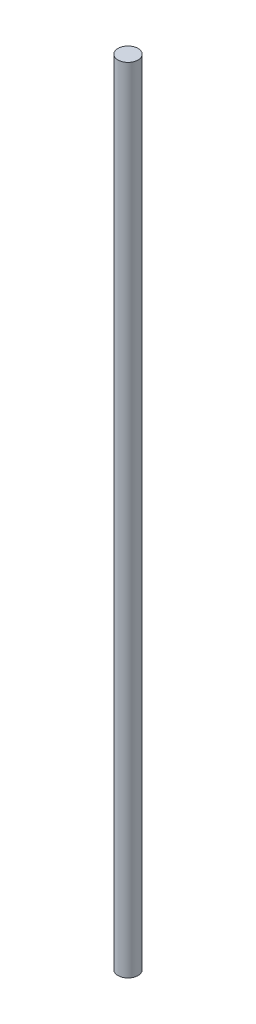
from build123d import *

# Parameters (mm, degrees)
SKETCH1_R           = 3
BOSS_EXTRUDE1_DEPTH = 236.982


with BuildPart() as part:
    # Sketch1 → Boss-Extrude1 (new body)
    with BuildSketch(Plane(origin=(0, 0, 0), x_dir=(1, 0, 0), z_dir=(0, 1, 0))):
        Circle(SKETCH1_R)
    extrude(amount=BOSS_EXTRUDE1_DEPTH)


solid = part.part
